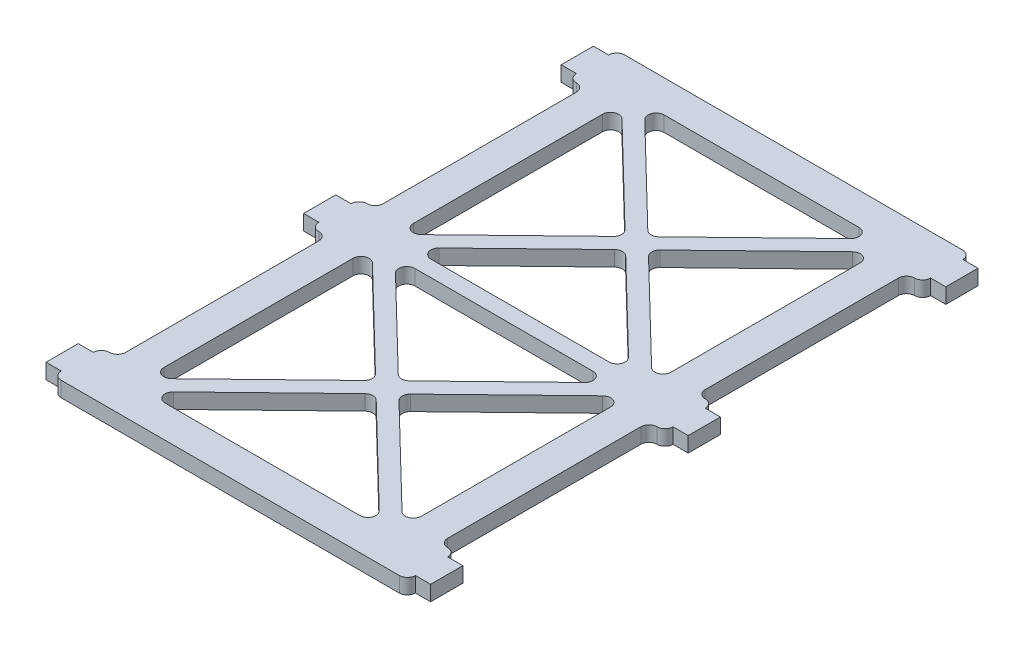
from build123d import *

# Parameters (mm, degrees)
SKETCH1_W           = 63.5
SKETCH1_H           = 111.125
BOSS_EXTRUDE1_DEPTH = 1.5
SKETCH2_W           = 3.175
SKETCH2_H           = 9.525
BOSS_EXTRUDE2_DEPTH = 3
CUT_EXTRUDE1_DEPTH  = 3
FILLET1_R           = 1.5875
SKETCH5_W           = 3
SKETCH5_H           = 6.35
BOSS_EXTRUDE3_DEPTH = 3


with BuildPart() as part:
    # Sketch1 → Boss-Extrude1 (new, symmetric)
    with BuildSketch(Plane(origin=(0, 34.29, 0), x_dir=(1, 0, 0), z_dir=(0, 1, 0))):
        with Locations((0, 120.65)):
            Rectangle(SKETCH1_W, SKETCH1_H)
    extrude(amount=BOSS_EXTRUDE1_DEPTH, both=True)

    # Sketch2 → Boss-Extrude2 (add)
    with BuildSketch(Plane(origin=(0, 35.79, 0), x_dir=(1, 0, 0), z_dir=(0, 1, 0))):
        with Locations((33.3375, 171.45)):
            Rectangle(SKETCH2_W, SKETCH2_H)
        with Locations((-33.3375, 171.45)):
            Rectangle(SKETCH2_W, SKETCH2_H)
        with Locations((33.3375, 120.65)):
            Rectangle(SKETCH2_W, SKETCH2_H)
        with Locations((-33.3375, 120.65)):
            Rectangle(SKETCH2_W, SKETCH2_H)
        with Locations((33.3375, 69.85)):
            Rectangle(SKETCH2_W, SKETCH2_H)
        with Locations((-33.3375, 69.85)):
            Rectangle(SKETCH2_W, SKETCH2_H)
    extrude(amount=-BOSS_EXTRUDE2_DEPTH)

    # Sketch4 → Cut-Extrude1 (cut)
    with BuildSketch(Plane(origin=(0, 35.79, 0), x_dir=(1, 0, 0), z_dir=(0, 1, 0))):
        Polygon((23.118437891, 169.8625), (-23.118437891, 169.8625), (0, 147.466513293), align=None)
        Polygon((-2.281562109, 145.25625), (-25.4, 167.652236707), (-25.4, 122.860263293), align=None)
        Polygon((25.4, 167.652236707), (2.281562109, 145.25625), (25.4, 122.860263293), align=None)
        Polygon((21.479728214, 122.2375), (0, 143.045986707), (-21.479728214, 122.2375), align=None)
        Polygon((-2.281562109, 96.04375), (-25.4, 118.439736707), (-25.4, 73.647763293), align=None)
        Polygon((21.479728214, 119.0625), (-21.479728214, 119.0625), (0, 98.254013293), align=None)
        Polygon((25.4, 73.647763293), (25.4, 118.439736707), (2.281562109, 96.04375), align=None)
        Polygon((23.118437891, 71.4375), (0, 93.833486707), (-23.118437891, 71.4375), align=None)
    extrude(amount=-CUT_EXTRUDE1_DEPTH, mode=Mode.SUBTRACT)

    # Fillet1
    fillet1_edges = [part.edges().sort_by_distance(p)[0] for p in [
        (-21.479728214, 34.29, -119.0625),
        (21.479728214, 34.29, -119.0625),
        (0, 34.29, -98.254013293),
        (-25.4, 34.29, -118.439736707),
        (-2.281562109, 34.29, -96.04375),
        (-25.4, 34.29, -73.647763293),
        (25.4, 34.29, -167.652236707),
        (25.4, 34.29, -122.860263293),
        (2.281562109, 34.29, -145.25625),
        (23.118437891, 34.29, -169.8625),
        (0, 34.29, -147.466513293),
        (-23.118437891, 34.29, -169.8625),
        (2.281562109, 34.29, -96.04375),
        (25.4, 34.29, -118.439736707),
        (25.4, 34.29, -73.647763293),
        (34.925, 34.29, -65.0875),
        (34.925, 34.29, -74.6125),
        (31.75, 34.29, -74.6125),
        (31.75, 34.29, -115.8875),
        (34.925, 34.29, -115.8875),
        (34.925, 34.29, -125.4125),
        (31.75, 34.29, -125.4125),
        (31.75, 34.29, -166.6875),
        (34.925, 34.29, -166.6875),
        (34.925, 34.29, -176.2125),
        (-34.925, 34.29, -166.6875),
        (-31.75, 34.29, -166.6875),
        (-31.75, 34.29, -125.4125),
        (-34.925, 34.29, -125.4125),
        (-34.925, 34.29, -115.8875),
        (-31.75, 34.29, -115.8875),
        (-31.75, 34.29, -74.6125),
        (-34.925, 34.29, -74.6125),
        (-34.925, 34.29, -65.0875),
        (-25.4, 34.29, -122.860263293),
        (-25.4, 34.29, -167.652236707),
        (-2.281562109, 34.29, -145.25625),
        (-23.118437891, 34.29, -71.4375),
        (0, 34.29, -93.833486707),
        (23.118437891, 34.29, -71.4375),
        (-21.479728214, 34.29, -122.2375),
        (0, 34.29, -143.045986707),
        (21.479728214, 34.29, -122.2375),
        (-34.925, 34.29, -176.2125),
    ]]
    fillet(fillet1_edges, radius=FILLET1_R - 0.0001)  # a hair under: the kernel refuses the full size

    # Sketch5 → Boss-Extrude3 (add)
    with BuildSketch(Plane(origin=(0, 35.79, 0), x_dir=(1, 0, 0), z_dir=(0, 1, 0))):
        with Locations((36.425, 171.45)):
            Rectangle(SKETCH5_W, SKETCH5_H)
        with Locations((-36.425, 171.45)):
            Rectangle(SKETCH5_W, SKETCH5_H)
        with Locations((36.425, 120.65)):
            Rectangle(SKETCH5_W, SKETCH5_H)
        with Locations((-36.425, 120.65)):
            Rectangle(SKETCH5_W, SKETCH5_H)
        with Locations((36.425, 69.85)):
            Rectangle(SKETCH5_W, SKETCH5_H)
        with Locations((-36.425, 69.85)):
            Rectangle(SKETCH5_W, SKETCH5_H)
    extrude(amount=-BOSS_EXTRUDE3_DEPTH)


solid = part.part
